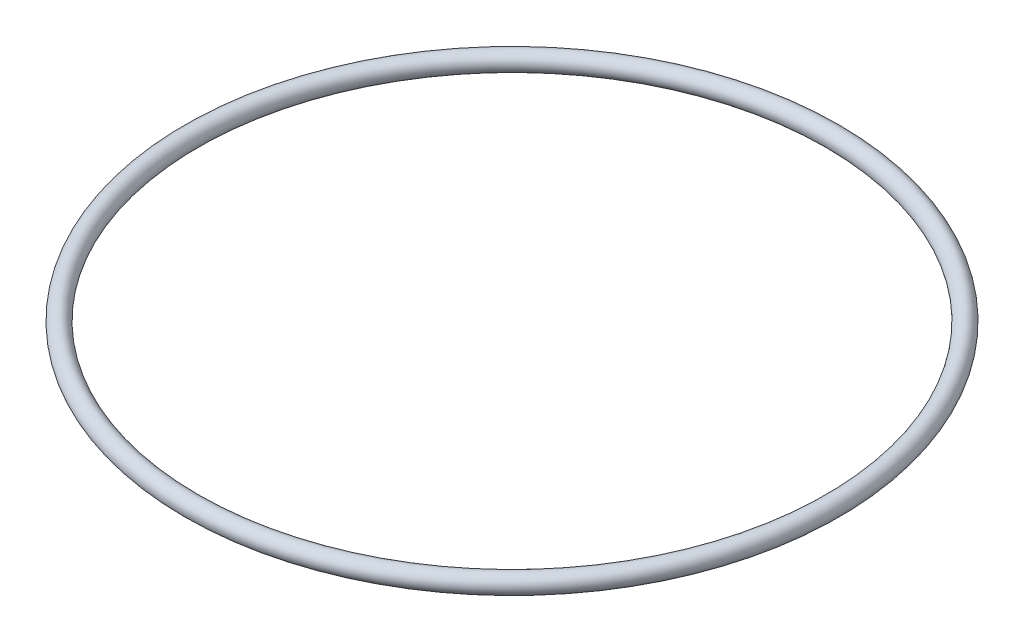
from build123d import *

# Parameters (mm, degrees)
SKETCH1_R = 1.25


with BuildPart() as part:
    # Sketch1 → Revolve1 (revolve)
    with BuildSketch(Plane.XY):
        with Locations((-43.4, 0)):
            Circle(SKETCH1_R)
    revolve(axis=Axis((0, 0, 0), (0, 1, 0)))


solid = part.part
